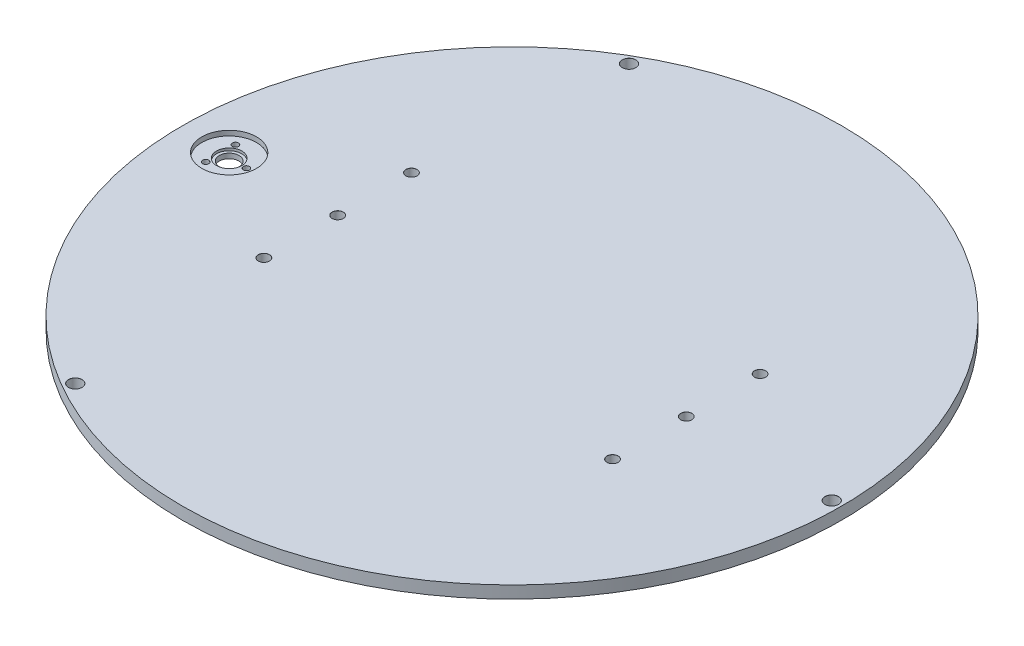
from build123d import *

# Parameters (mm, degrees)
STOCK_NEW_TRACKER_1_OUTLINE_R  = 10.415
STOCK_NEW_TRACKER_1_DEPTH      = 10
FILLET1_R                      = 12.7
SKETCH6_R                      = 10.4
CUT_EXTRUDE5_DEPTH             = 243.280828936
CUT_EXTRUDE1_START             = -5
CUT_EXTRUDE1_DEPTH             = 5
SKETCH2_R                      = 10.415
SKETCH2_R_2                    = 4
BOSS_EXTRUDE1_DEPTH            = 5
SKETCH3_R                      = 5.15
CUT_EXTRUDE2_DEPTH             = 3
SKETCH4_R                      = 11.125
CUT_EXTRUDE3_DEPTH             = 2
SKETCH5_R                      = 1.25
CUT_EXTRUDE4_DEPTH             = 243.092957495
SKETCH7_R                      = 190
SKETCH7_R_2                    = 134
CUT_EXTRUDE6_DEPTH             = 243.126000399
M5_CLEARANCE_HOLE1_D           = 5.5
M5_CLEARANCE_HOLE1_DEPTH       = 7.5
M5_CLEARANCE_HOLE1_CSINK_D     = 5.55
M5_CLEARANCE_HOLE1_CSINK_ANGLE = 90
M5_CLEARANCE_HOLE1_TIP         = 1.652366702
M4_CLEARANCE_HOLE1_D           = 4.5
M4_CLEARANCE_HOLE1_DEPTH       = 7.5
M4_CLEARANCE_HOLE1_CSINK_D     = 4.55
M4_CLEARANCE_HOLE1_CSINK_ANGLE = 90
M4_CLEARANCE_HOLE1_TIP         = 1.351936393


# Read off the part's stored shape, not the designer's step: Stock-New_Tracker-1
with BuildPart() as part:
    # Stock-New_Tracker-1 outline → Stock-New_Tracker-1 (new body)
    with BuildSketch(Plane(origin=(0, 0, 0), x_dir=(1, 0, 0), z_dir=(0, 1, 0))):
        with BuildLine():
            ThreePointArc((144.666666667, 39.642849993), (-150, 0), (144.666666667, -39.642849993))
            ThreePointArc((144.666666667, -39.642849993), (190, 0), (144.666666667, 39.642849993))
        make_face()
        with Locations((168.805, 0)):
            Circle(STOCK_NEW_TRACKER_1_OUTLINE_R, mode=Mode.SUBTRACT)
    extrude(amount=STOCK_NEW_TRACKER_1_DEPTH)

    # Fillet1
    fillet1_edges = [part.edges().sort_by_distance(p)[0] for p in [
        (144.666666667, 5, 39.642849993),
        (144.666666667, 5, -39.642849993),
    ]]
    fillet(fillet1_edges, radius=FILLET1_R)

    # Sketch6 → Cut-Extrude5 (cut, through all)
    with BuildSketch(Plane.XZ):
        with Locations(Location((-115, 0, 0), (0, 0, 270))):
            Circle(SKETCH6_R)
    extrude(amount=-CUT_EXTRUDE5_DEPTH, mode=Mode.SUBTRACT)

    # Sketch1 → Cut-Extrude1 (cut)
    with BuildSketch(Plane(origin=(0, 10, 0), x_dir=(1, 0, 0), z_dir=(0, 1, 0)).offset(CUT_EXTRUDE1_START)):
        with BuildLine():
            ThreePointArc((153.020872865, -39.885765971), (190, 0), (153.020872865, 39.885765971))
            ThreePointArc((153.020872865, 39.885765971), (146.205916285, 42.506906245), (141.960663798, 48.447599878))
            ThreePointArc((141.960663798, 48.447599878), (-150, 0), (141.960663798, -48.447599878))
            ThreePointArc((141.960663798, -48.447599878), (146.205916285, -42.506906245), (153.020872865, -39.885765971))
        make_face()
    extrude(amount=CUT_EXTRUDE1_DEPTH, mode=Mode.SUBTRACT)

    # Sketch2 → Boss-Extrude1 (add)
    with BuildSketch(Plane.XZ):
        with Locations((-115, 0)):
            Circle(SKETCH2_R)
        with Locations(Location((-115, 0, 0), (0, 0, 270))):
            Circle(SKETCH2_R_2, mode=Mode.SUBTRACT)
    extrude(amount=-BOSS_EXTRUDE1_DEPTH)

    # Sketch3 → Cut-Extrude2 (cut)
    with BuildSketch(Plane(origin=(0, 5, 0), x_dir=(1, 0, 0), z_dir=(0, 1, 0))):
        with Locations(Location((-115, 0, 0), (0, 0, 270))):
            Circle(SKETCH3_R)
    extrude(amount=-CUT_EXTRUDE2_DEPTH, mode=Mode.SUBTRACT)

    # Sketch4 → Cut-Extrude3 (cut)
    with BuildSketch(Plane(origin=(0, 5, 0), x_dir=(1, 0, 0), z_dir=(0, 1, 0))):
        with Locations(Location((-115, 0, 0), (0, 0, 270))):
            Circle(SKETCH4_R)
    extrude(amount=-CUT_EXTRUDE3_DEPTH, mode=Mode.SUBTRACT)

    # Sketch5 → Cut-Extrude4 (cut, through all)
    with BuildSketch(Plane(origin=(0, 3, 0), x_dir=(1, 0, 0), z_dir=(0, 1, 0))):
        with Locations(Location((-118.5, -6.062177826, 0), (0, 0, 270))):
            Circle(SKETCH5_R)
        with Locations(Location((-118.5, 6.062177826, 0), (0, 0, 270))):
            Circle(SKETCH5_R)
        with Locations(Location((-108, 0, 0), (0, 0, 270))):
            Circle(SKETCH5_R)
    extrude(amount=-CUT_EXTRUDE4_DEPTH, mode=Mode.SUBTRACT)

    # Sketch7 → Cut-Extrude6 (cut, through all)
    with BuildSketch(Plane(origin=(0, 5, 0), x_dir=(1, 0, 0), z_dir=(0, 1, 0))):
        Circle(SKETCH7_R)
        with Locations(Location((0, 0, 0), (0, 0, 270))):
            Circle(SKETCH7_R_2, mode=Mode.SUBTRACT)
    extrude(amount=-CUT_EXTRUDE6_DEPTH, mode=Mode.SUBTRACT)

    # M5 Clearance Hole1
    with Locations(Plane(origin=(0, 5, 0), x_dir=(1, 0, 0), z_dir=(0, 1, 0))):
        with Locations((-65, 112.583302492), (130, 0), (-65, -112.583302492)):
            CounterSinkHole(M5_CLEARANCE_HOLE1_D / 2, M5_CLEARANCE_HOLE1_CSINK_D / 2, depth=M5_CLEARANCE_HOLE1_DEPTH, counter_sink_angle=M5_CLEARANCE_HOLE1_CSINK_ANGLE)
            with Locations((0, 0, -(M5_CLEARANCE_HOLE1_DEPTH + M5_CLEARANCE_HOLE1_TIP / 2))):  # 118° drill point
                Cone(0, M5_CLEARANCE_HOLE1_D / 2, M5_CLEARANCE_HOLE1_TIP, mode=Mode.SUBTRACT)

    # M4 Clearance Hole1
    with Locations(Plane(origin=(0, 5, 0), x_dir=(1, 0, 0), z_dir=(0, 1, 0))):
        with Locations((-70.875, -30), (-70.875, 0), (-70.875, 30), (70.875, -30), (70.875, 0), (70.875, 30)):
            CounterSinkHole(M4_CLEARANCE_HOLE1_D / 2, M4_CLEARANCE_HOLE1_CSINK_D / 2, depth=M4_CLEARANCE_HOLE1_DEPTH, counter_sink_angle=M4_CLEARANCE_HOLE1_CSINK_ANGLE)
            with Locations((0, 0, -(M4_CLEARANCE_HOLE1_DEPTH + M4_CLEARANCE_HOLE1_TIP / 2))):  # 118° drill point
                Cone(0, M4_CLEARANCE_HOLE1_D / 2, M4_CLEARANCE_HOLE1_TIP, mode=Mode.SUBTRACT)


solid = part.part
